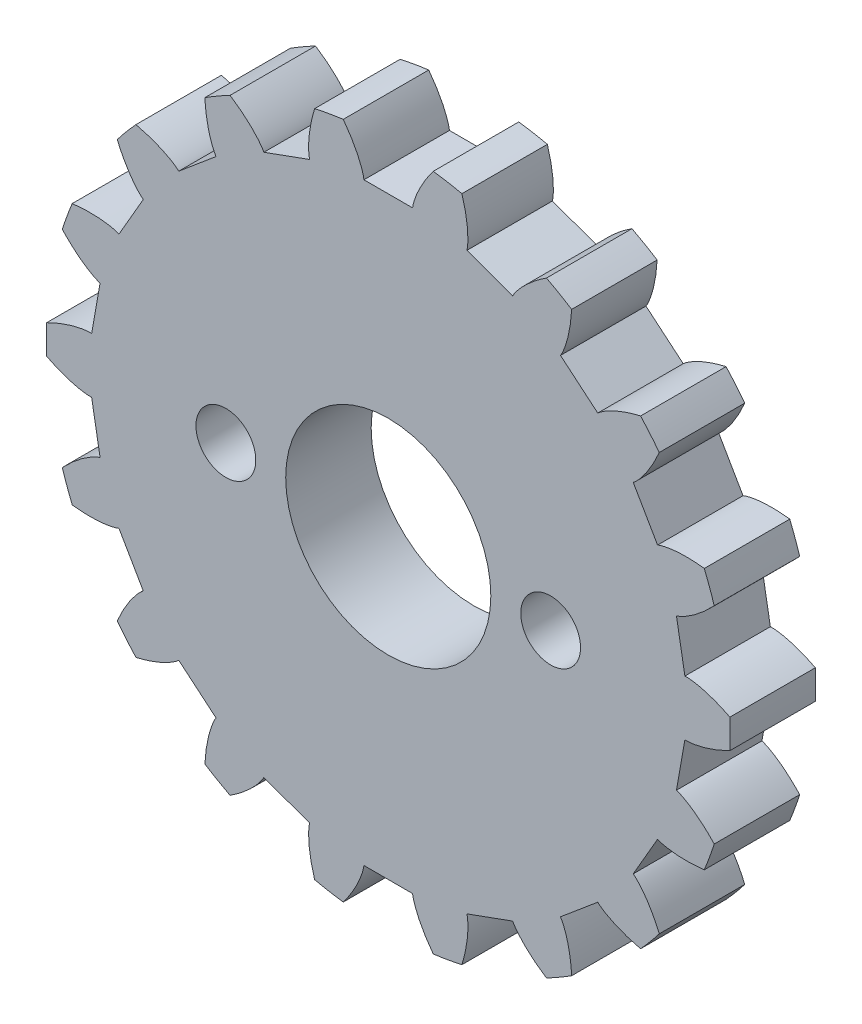
from build123d import *

# Parameters (mm, degrees)
SKETCH1_W               = 20
SKETCH1_H               = 5
CUT_EXTRUDE2_DEPTH      = 6
CIRPATTERN1_COUNT       = 18
CUT_EXTRUDE4_DEPTH      = 7
CUT_EXTRUDE4_DEPTH_BACK = 7
SKETCH3_R               = 6
SKETCH3_R_2             = 1.75


with BuildPart() as part:
    # Sketch1 → Revolve1 (revolve)
    with BuildSketch(Plane(origin=(0, 0, 0), x_dir=(1, 0, 0), z_dir=(0, 1, 0))):
        with Locations((10, -2.5)):
            Rectangle(SKETCH1_W, SKETCH1_H)
    revolve(axis=Axis((0, 0, 1), (0, 0, 1)))

    # Sketch2 → Cut-Extrude2 (cut, symmetric)
    with BuildSketch(Plane.XY):
        with BuildLine():
            add(Edge.make_bspline(
                [(17.351655252, 1.615069838), (17.355728073, 1.615400042), (17.367164056, 1.616175937), (17.388832903, 1.617049318), (17.424249609, 1.617630679), (17.469453629, 1.617130568), (17.527953339, 1.615058377), (17.596944484, 1.610782864), (17.672825272, 1.60416177), (17.755425477, 1.594883344), (17.837854393, 1.583791845), (17.920087039, 1.571019833), (18.001998309, 1.55675677), (18.101195436, 1.537660206), (18.220098078, 1.512232763), (18.358967282, 1.478830414), (18.516301695, 1.436604477), (18.676416113, 1.388931894), (18.833754182, 1.338213444), (18.992417806, 1.282598559), (19.145712895, 1.225691887), (19.304557696, 1.162118069), (19.450989469, 1.101164162), (19.614558254, 1.02794534), (19.746422348, 0.96741698), (19.882187746, 0.900791407), (19.948197318, 0.867759863), (19.981902714, 0.850624245)],
                knots=[3.8e-08, 3.8e-08, 3.8e-08, 3.8e-08, 3.8e-08, 0.005376749, 0.015083688, 0.02853182, 0.04661014, 0.064854849, 0.092110526, 0.119476176, 0.146842496, 0.174208854, 0.201574956, 0.228941013, 0.256307345, 0.307035032, 0.361767352, 0.416499661, 0.471231937, 0.525964282, 0.580696616, 0.635428982, 0.690161387, 0.744893688, 0.799626082, 0.854358407, 0.909090939, 0.909090939, 0.909090939, 0.909090939, 0.909090939], degree=4))
            add(Edge.make_bspline(
                [(19.981902714, 0.850624245), (20.456517287, 0.870828427), (21.393740476, 0.910725765), (23.849974777, 1.015286998), (25.571032415, 1.088551957), (28.169974217, 1.199188209), (30.227911533, 1.286794046), (32.562620683, 1.386181985), (34.725951769, 1.478274407), (36.811655324, 1.567062245), (38.614947071, 1.643827888), (40.353108281, 1.717820943), (42.012787616, 1.788473044), (43.749975557, 1.862424667), (45.53936531, 1.938598506), (47.288462752, 2.013057113), (49.005269954, 2.086141133), (50.685808453, 2.157681204), (52.495760695, 2.234730383), (54.061724174, 2.301393026), (55.894071965, 2.379395578), (57.194754565, 2.434765285), (58.887522028, 2.50682594), (59.541022443, 2.534645276), (59.945588429, 2.551867541)],
                knots=[0.083333333, 0.083333333, 0.083333333, 0.083333333, 0.083333333, 0.130837912, 0.181418842, 0.230855082, 0.273351648, 0.320856227, 0.369076236, 0.415364583, 0.460365156, 0.490842491, 0.521605998, 0.559333028, 0.599230197, 0.63578869, 0.670272436, 0.706437443, 0.740241529, 0.779733288, 0.814741682, 0.847842262, 0.876173306, 0.916666667, 0.916666667, 0.916666667, 0.916666667, 0.916666667], degree=4))
            add(Edge.make_bspline(
                [(59.945588429, 2.551867541), (59.938905529, 2.708854667), (59.924310791, 3.014548446), (59.884419367, 3.784499238), (59.840390783, 4.372806466), (59.775742098, 5.223167976), (59.708338498, 5.914697471), (59.627500908, 6.700665116), (59.539589409, 7.428048782), (59.440969283, 8.188733013), (59.333543539, 8.927864296), (59.216719225, 9.676814689), (59.090003431, 10.419161883), (58.955179634, 11.160079417), (58.80880246, 11.903818844), (58.656951851, 12.635116824), (58.489455127, 13.383656253), (58.323285048, 14.09724082), (58.130430768, 14.8634569), (57.957252417, 15.536335452), (57.727161544, 16.357525041), (57.567321958, 16.925411664), (57.341468954, 17.662572413), (57.250630092, 17.954822295), (57.203217205, 18.104627625)],
                knots=[0.083333333, 0.083333333, 0.083333333, 0.083333333, 0.083333333, 0.123015873, 0.162698413, 0.202380952, 0.242063492, 0.281746032, 0.321428571, 0.361111111, 0.400793651, 0.44047619, 0.48015873, 0.51984127, 0.55952381, 0.599206349, 0.638888889, 0.678571429, 0.718253968, 0.757936508, 0.797619048, 0.837301587, 0.876984127, 0.916666667, 0.916666667, 0.916666667, 0.916666667, 0.916666667], degree=4))
            add(Edge.make_bspline(
                [(57.203217205, 18.104627625), (56.910536106, 18.011995033), (56.319657649, 17.82498397), (54.890386173, 17.37262431), (53.799885477, 17.027484474), (52.207318099, 16.523442205), (50.713896955, 16.050779389), (48.895317658, 15.475205101), (47.13776305, 14.918944924), (45.189428594, 14.30230356), (43.422731107, 13.743149692), (41.584720939, 13.161425598), (39.694989725, 12.563331966), (37.801950234, 11.964191274), (35.869316319, 11.35251908), (33.834934173, 10.708643909), (31.95104968, 10.112400744), (29.757887016, 9.418272069), (27.788585628, 8.794994741), (25.114775454, 7.94874273), (23.255356987, 7.360242981), (20.622128403, 6.526834908), (19.60873591, 6.206099561), (19.067777207, 6.034887934)],
                knots=[0.083333333, 0.083333333, 0.083333333, 0.083333333, 0.083333333, 0.114032452, 0.147736378, 0.172793136, 0.205729167, 0.23839393, 0.287560096, 0.325270433, 0.36338141, 0.40627504, 0.443659856, 0.48455028, 0.529947917, 0.569928552, 0.615284455, 0.658128005, 0.701522436, 0.750450721, 0.806189904, 0.859925881, 0.916666667, 0.916666667, 0.916666667, 0.916666667, 0.916666667], degree=4))
            add(Edge.make_bspline(
                [(16.857608867, 4.416946438), (16.861549004, 4.418029135), (16.872560684, 4.421211369), (16.893221453, 4.427801841), (16.926701108, 4.439368767), (16.969007944, 4.455299404), (17.023270959, 4.477254705), (17.086639117, 4.504868734), (17.155679186, 4.537043285), (17.23012458, 4.574013088), (17.303788909, 4.612628038), (17.376694034, 4.652755024), (17.448787196, 4.694173223), (17.535470594, 4.746045539), (17.638505831, 4.810606619), (17.757575922, 4.889490625), (17.890979787, 4.982981564), (18.025133141, 5.082541495), (18.155635832, 5.184014037), (18.285709457, 5.29054109), (18.410296493, 5.396445877), (18.537818255, 5.510513847), (18.654571647, 5.617874399), (18.783233715, 5.742621405), (18.886443513, 5.844599634), (18.991233968, 5.953641695), (19.041965222, 6.007257796), (19.067777207, 6.034887934)],
                knots=[0, 0, 0, 0, 0, 0.005376749, 0.015083688, 0.02853182, 0.04661014, 0.064854849, 0.092110526, 0.119476176, 0.146842496, 0.174208854, 0.201574956, 0.228941013, 0.256307345, 0.307035032, 0.361767352, 0.416499661, 0.471231937, 0.525964282, 0.580696616, 0.635428982, 0.690161387, 0.744893688, 0.799626082, 0.854358407, 0.909090914, 0.909090914, 0.909090914, 0.909090914, 0.909090914], degree=4))
            add(Edge.make_bspline(
                [(16.857608867, 4.416946438), (16.862071247, 4.391639023), (16.871812599, 4.336393073), (16.895923809, 4.199651606), (16.914550105, 4.094016633), (16.941507645, 3.941132823), (16.962977993, 3.819368432), (16.987148393, 3.682291283), (17.009426274, 3.555947136), (17.032268156, 3.42640439), (17.054415738, 3.300799207), (17.076425465, 3.175975843), (17.098918688, 3.048410436), (17.120740549, 2.924652512), (17.143511026, 2.795514719), (17.166438, 2.665489391), (17.189306389, 2.535796309), (17.212913109, 2.401915946), (17.240068336, 2.247911002), (17.264501475, 2.109343785), (17.295013175, 1.936303337), (17.31546951, 1.820289695), (17.338482532, 1.689776361), (17.347484532, 1.638723483), (17.351655252, 1.615069838)],
                knots=[0.083333333, 0.083333333, 0.083333333, 0.083333333, 0.083333333, 0.119462569, 0.163604625, 0.204741873, 0.241371909, 0.28289072, 0.319568452, 0.360777244, 0.395976419, 0.434538118, 0.470381181, 0.508585165, 0.547933837, 0.582059867, 0.623197115, 0.664835165, 0.699461996, 0.745821886, 0.798763736, 0.843454289, 0.882898352, 0.916666667, 0.916666667, 0.916666667, 0.916666667, 0.916666667], degree=4))
        make_face()
    cut_extrude2 = extrude(amount=CUT_EXTRUDE2_DEPTH, both=True, mode=Mode.SUBTRACT)

    # CirPattern1: Cut-Extrude2 ×18 about axis
    cirpattern1_axis = Axis((0, 0, -0.25), (0, 0, 1))
    for i in range(1, CIRPATTERN1_COUNT):
        add(cut_extrude2.rotate(cirpattern1_axis, i * 360 / CIRPATTERN1_COUNT), mode=Mode.SUBTRACT)

    # Sketch3 → Cut-Extrude4 (cut, two sides: drawn at the far end of the back side and taken through both)
    with BuildSketch(Plane.XY.offset(-CUT_EXTRUDE4_DEPTH_BACK)):
        Circle(SKETCH3_R)
        with Locations((9.5, 0)):
            Circle(SKETCH3_R_2)
        with Locations((-9.5, 0)):
            Circle(SKETCH3_R_2)
    extrude(amount=CUT_EXTRUDE4_DEPTH + CUT_EXTRUDE4_DEPTH_BACK, mode=Mode.SUBTRACT)


solid = part.part
